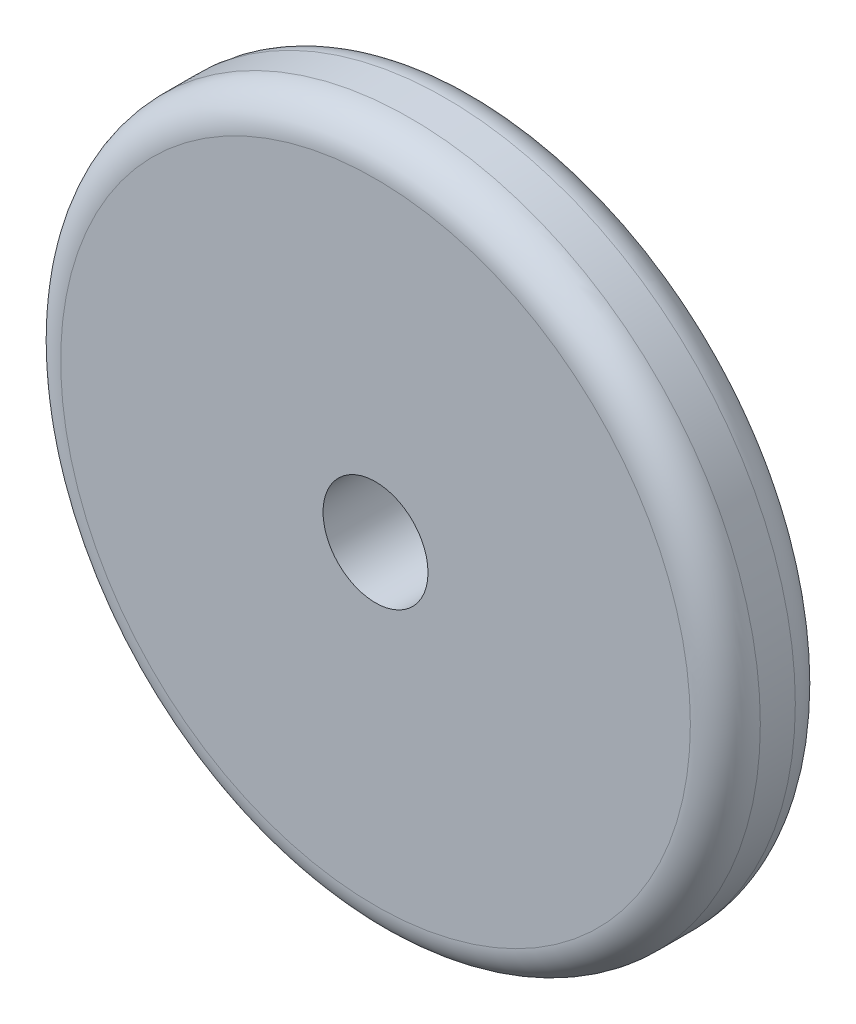
from build123d import *

# Parameters (mm, degrees)
SKETCH1_R           = 10
SKETCH1_R_2         = 1.5
BOSS_EXTRUDE1_DEPTH = 3
FILLET1_R           = 1


with BuildPart() as part:
    # Sketch1 → Boss-Extrude1 (new body)
    with BuildSketch(Plane.XY):
        Circle(SKETCH1_R)
        Circle(SKETCH1_R_2, mode=Mode.SUBTRACT)
    extrude(amount=BOSS_EXTRUDE1_DEPTH)

    # Fillet1
    fillet1_edges = [part.edges().sort_by_distance(p)[0] for p in [
        (-10, 0, 0),
        (-10, 0, 3),
    ]]
    fillet(fillet1_edges, radius=FILLET1_R)


solid = part.part
